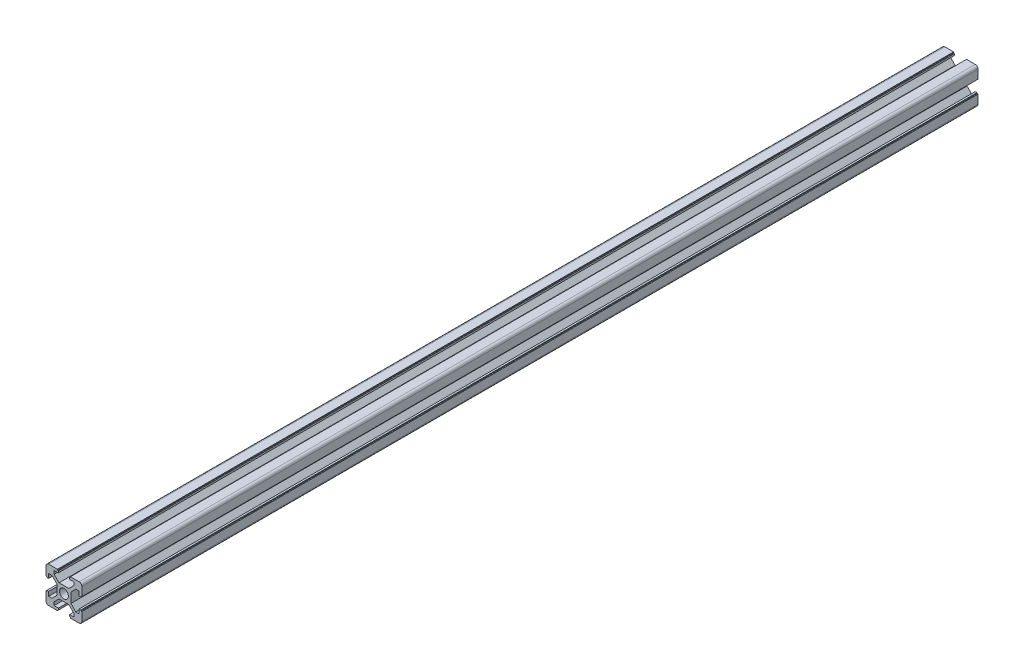
from build123d import *

# Parameters (mm, degrees)
EXTRUDE_1_DEPTH     = 500
SKETCH_2_R          = 2.05
CUT_EXTRUDE_1_DEPTH = 501.293124078


with BuildPart() as part:
    # 草图1 → 凸台-拉伸1 (new body)
    with BuildSketch(Plane.XY):
        with BuildLine():
            Line((8.5, 10), (3.6, 10))
            Line((3.6, 10), (3.6, 9.5))
            Line((3.6, 9.5), (3.1, 9.5))
            Line((3.1, 9.5), (3.1, 8.5))
            Line((3.1, 8.5), (5.5, 8.5))
            Line((5.5, 8.5), (5.5, 6.65))
            Line((5.5, 6.65), (2.75, 3.9))
            Line((2.75, 3.9), (-2.75, 3.9))
            Line((-2.75, 3.9), (-5.5, 6.65))
            Line((-5.5, 6.65), (-5.5, 8.5))
            Line((-5.5, 8.5), (-3.1, 8.5))
            Line((-3.1, 8.5), (-3.1, 9.5))
            Line((-3.1, 9.5), (-3.6, 9.5))
            Line((-3.6, 9.5), (-3.6, 10))
            Line((-3.6, 10), (-8.5, 10))
            ThreePointArc((-8.5, 10), (-9.560660172, 9.560660172), (-10, 8.5))
            Line((-10, 8.5), (-10, 3.6))
            Line((-10, 3.6), (-9.5, 3.6))
            Line((-9.5, 3.6), (-9.5, 3.1))
            Line((-9.5, 3.1), (-8.5, 3.1))
            Line((-8.5, 3.1), (-8.5, 5.5))
            Line((-8.5, 5.5), (-6.65, 5.5))
            Line((-6.65, 5.5), (-3.9, 2.75))
            Line((-3.9, 2.75), (-3.9, -2.75))
            Line((-3.9, -2.75), (-6.65, -5.5))
            Line((-6.65, -5.5), (-8.5, -5.5))
            Line((-8.5, -5.5), (-8.5, -3.1))
            Line((-8.5, -3.1), (-9.5, -3.1))
            Line((-9.5, -3.1), (-9.5, -3.6))
            Line((-9.5, -3.6), (-10, -3.6))
            Line((-10, -3.6), (-10, -8.5))
            ThreePointArc((-10, -8.5), (-9.560660172, -9.560660172), (-8.5, -10))
            Line((-8.5, -10), (-3.6, -10))
            Line((-3.6, -10), (-3.6, -9.5))
            Line((-3.6, -9.5), (-3.1, -9.5))
            Line((-3.1, -9.5), (-3.1, -8.5))
            Line((-3.1, -8.5), (-5.5, -8.5))
            Line((-5.5, -8.5), (-5.5, -6.65))
            Line((-5.5, -6.65), (-2.75, -3.9))
            Line((-2.75, -3.9), (2.75, -3.9))
            Line((2.75, -3.9), (5.5, -6.65))
            Line((5.5, -6.65), (5.5, -8.5))
            Line((5.5, -8.5), (3.1, -8.5))
            Line((3.1, -8.5), (3.1, -9.5))
            Line((3.1, -9.5), (3.6, -9.5))
            Line((3.6, -9.5), (3.6, -10))
            Line((3.6, -10), (8.5, -10))
            ThreePointArc((8.5, -10), (9.560660172, -9.560660172), (10, -8.5))
            Line((10, -8.5), (10, -3.6))
            Line((10, -3.6), (9.5, -3.6))
            Line((9.5, -3.6), (9.5, -3.1))
            Line((9.5, -3.1), (8.5, -3.1))
            Line((8.5, -3.1), (8.5, -5.5))
            Line((8.5, -5.5), (6.65, -5.5))
            Line((6.65, -5.5), (3.9, -2.75))
            Line((3.9, -2.75), (3.9, 2.75))
            Line((3.9, 2.75), (6.65, 5.5))
            Line((6.65, 5.5), (8.5, 5.5))
            Line((8.5, 5.5), (8.5, 3.1))
            Line((8.5, 3.1), (9.5, 3.1))
            Line((9.5, 3.1), (9.5, 3.6))
            Line((9.5, 3.6), (10, 3.6))
            Line((10, 3.6), (10, 8.5))
            ThreePointArc((10, 8.5), (9.560660172, 9.560660172), (8.5, 10))
        make_face()
        with BuildLine():
            ThreePointArc((-2.5, 0), (0, -2.5), (2.5, 0))
            ThreePointArc((2.5, 0), (0, 2.5), (-2.5, 0))
        make_face(mode=Mode.SUBTRACT)
    extrude(amount=EXTRUDE_1_DEPTH)

    # 草图2 → 切除-拉伸1 (cut, through all)
    with BuildSketch(Plane(origin=(0, 3.9, 0), x_dir=(1, 0, 0), z_dir=(0, 1, 0))):
        with Locations((0, -250)):
            Circle(SKETCH_2_R)
        with Locations((0, -125)):
            Circle(SKETCH_2_R)
        with Locations((0, -375)):
            Circle(SKETCH_2_R)
    extrude(amount=-CUT_EXTRUDE_1_DEPTH, mode=Mode.SUBTRACT)


solid = part.part
